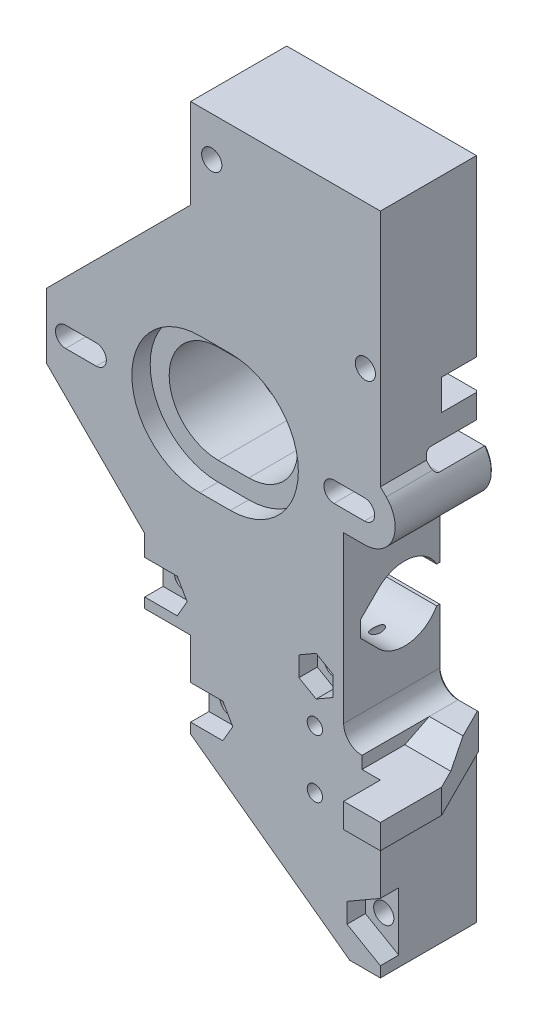
from build123d import *

# Parameters (mm, degrees)
SKETCH1_R                = 8
SKETCH1_R_2              = 1.65
BOSS_EXTRUDE1_DEPTH      = 16
CUT_EXTRUDE1_DEPTH       = 74.561199011
CUT_EXTRUDE1_DEPTH_BACK  = 14
CUT_EXTRUDE12_DEPTH      = 74.561199033
CUT_EXTRUDE20_DEPTH      = 6
SKETCH19_R               = 11.1
CUT_EXTRUDE24_DEPTH      = 3
CUT_EXTRUDE26_DEPTH      = 3
CHAMFER4_SIZE            = 6
CHAMFER4_SIZE2           = 12
CHAMFER5_START           = -47
CHAMFER5_OUTLINE_W       = 31
CHAMFER5_OUTLINE_H       = 25
CHAMFER5_DEPTH           = 10.119933969
CUT_EXTRUDE27_DEPTH      = 74.561199033
CUT_EXTRUDE28_DEPTH      = 3
SKETCH24_W               = 6
SKETCH24_H               = 6
BOSS_EXTRUDE2_DEPTH      = 6
CUT_EXTRUDE29_REACH      = 91.157
CUT_EXTRUDE29_END_RADIUS = 8
FILLET1_R                = 3
SKETCH26_W               = 9
SKETCH26_H               = 13
CUT_EXTRUDE30_DEPTH      = 2
CHAMFER6_SIZE            = 4
CHAMFER6_SIZE_2          = 2
CHAMFER7_SIZE            = 0.3
SKETCH27_R               = 1.25
CUT_EXTRUDE31_DEPTH      = 10


with BuildPart() as part:
    # Sketch1 → Boss-Extrude1 (new body)
    with BuildSketch(Plane.XY):
        with BuildLine():
            Line((18.5, -5), (18.5, -35))
            Line((18.5, -35), (30.5, -35))
            Line((30.5, -35), (30.5, -41))
            Line((30.5, -41), (24.5, -41))
            Line((24.5, -41), (24.5, -65))
            Line((24.5, -65), (-6.5, -65))
            Line((-6.5, -65), (-6.5, -32))
            Line((-6.5, -32), (-14, -32))
            Line((-14, -32), (-14, -21.355339059))
            Line((-14, -21.355339059), (-30, -5.355339059))
            Line((-30, -5.355339059), (-30, 5.355339059))
            Line((-30, 5.355339059), (-6.5, 28.855339059))
            Line((-6.5, 28.855339059), (-6.5, 43.5))
            Line((-6.5, 43.5), (24.5, 43.5))
            Line((24.5, 43.5), (24.5, 4.491378029))
            Line((24.5, 4.491378029), (25.455844123, 3.535533906))
            ThreePointArc((25.455844123, 3.535533906), (26.539707879, -1.913417162), (21.920310217, -5))
            Line((21.920310217, -5), (18.5, -5))
        make_face()
        Circle(SKETCH1_R, mode=Mode.SUBTRACT)
        with Locations((22.05, 20)):
            Circle(SKETCH1_R_2, mode=Mode.SUBTRACT)
        with Locations((-3.05, 37)):
            Circle(SKETCH1_R_2, mode=Mode.SUBTRACT)
        with Locations((21.920310217, 0)):
            Circle(SKETCH1_R_2, mode=Mode.SUBTRACT)
        with Locations((-21.920310217, 0)):
            Circle(SKETCH1_R_2, mode=Mode.SUBTRACT)
        with Locations((14, -27.55)):
            Circle(SKETCH1_R_2, mode=Mode.SUBTRACT)
        with Locations((-10.5, -27.55)):
            Circle(SKETCH1_R_2, mode=Mode.SUBTRACT)
        with Locations((-3.05, -41.5)):
            Circle(SKETCH1_R_2, mode=Mode.SUBTRACT)
        with Locations((22.05, -58.5)):
            Circle(SKETCH1_R_2, mode=Mode.SUBTRACT)
    extrude(amount=BOSS_EXTRUDE1_DEPTH)

    # Sketch2 → Cut-Extrude1 (cut, two sides: drawn at the far end of the back side and taken through both)
    with BuildSketch(Plane(origin=(0, 0, 0), x_dir=(0, 0, -1), z_dir=(1, 0, 0)).offset(-CUT_EXTRUDE1_DEPTH_BACK)):
        with BuildLine():
            Line((-0.800624517, -17.042859144), (0, -17.042859144))
            Line((0, -17.042859144), (0, -22.957140856))
            Line((0, -22.957140856), (-0.800624517, -22.957140856))
            ThreePointArc((-0.800624517, -22.957140856), (-5.231998533, -25.969212561), (-10.310318357, -24.260318357))
            Line((-10.310318357, -24.260318357), (-13.275, -21.295636713))
            Line((-13.275, -21.295636713), (-13.275, -18.704363287))
            Line((-13.275, -18.704363287), (-10.310318357, -15.739681643))
            ThreePointArc((-10.310318357, -15.739681643), (-5.231998533, -14.030787439), (-0.800624517, -17.042859144))
        make_face()
    extrude(amount=CUT_EXTRUDE1_DEPTH + CUT_EXTRUDE1_DEPTH_BACK, mode=Mode.SUBTRACT)

    # Sketch7 → Cut-Extrude12 (cut, through all)
    with BuildSketch(Plane(origin=(0, 0, 0), x_dir=(0, 0, -1), z_dir=(1, 0, 0))):
        with BuildLine():
            Line((-7, 6.1), (0, 6.1))
            ThreePointArc((0, 6.1), (1.5, 4.6), (0, 3.1))
            Line((0, 3.1), (-7, 3.1))
            ThreePointArc((-7, 3.1), (-8.5, 4.6), (-7, 6.1))
        make_face()
        with BuildLine():
            Line((-7, -6.1), (0, -6.1))
            ThreePointArc((0, -6.1), (1.5, -4.6), (0, -3.1))
            Line((0, -3.1), (-7, -3.1))
            ThreePointArc((-7, -3.1), (-8.5, -4.6), (-7, -6.1))
        make_face()
    extrude(amount=CUT_EXTRUDE12_DEPTH, mode=Mode.SUBTRACT)

    # Sketch15 → Cut-Extrude20 (cut)
    with BuildSketch(Plane(origin=(24.5, 0, 0), x_dir=(0, 0, -1), z_dir=(1, 0, 0))):
        Polygon((0, 10), (-8, 10), (-8, 15), (0, 15), (0, 14.529529041), align=None)
    extrude(amount=-CUT_EXTRUDE20_DEPTH, mode=Mode.SUBTRACT)

    # Chamfer1
    # the kernel refuses this chamfer: 8 mm, written as the material it adds along each edge
    with BuildSketch(Plane(origin=(18.5, 10, 8), x_dir=(0, 0, -1), z_dir=(0, 1, 0))) as chamfer1_piece_1_section:
        with BuildLine():
            Line((8.22627417, 0.22627417), (-0.22627417, -8.22627417))
            Line((-0.22627417, -8.22627417), (-0.38627417, -8.22627417))
            ThreePointArc((-0.38627417, -8.22627417), (-0.16, -4.113137085), (-0.16, 0))
            Line((-0.16, 0), (0, 0.16))
            ThreePointArc((0, 0.16), (4.113137085, 0.16), (8.22627417, 0.38627417))
            Line((8.22627417, 0.38627417), (8.22627417, 0.22627417))
        make_face()
    chamfer1_piece_1 = extrude(amount=5, mode=Mode.PRIVATE)
    chamfer1_piece_1 = split(chamfer1_piece_1, bisect_by=Plane(origin=(18.5, 10, 0), z_dir=(0, 0, 1)), keep=Keep.TOP, mode=Mode.PRIVATE)
    chamfer1_piece_1 = split(chamfer1_piece_1, bisect_by=Plane(origin=(24.5, 10, 8), z_dir=(-1, 0, 0)), keep=Keep.TOP, mode=Mode.PRIVATE)
    add(chamfer1_piece_1)

    # Sketch19 → Cut-Extrude24 (cut)
    with BuildSketch(Plane.XY.offset(16)):
        Circle(SKETCH19_R)
    extrude(amount=-CUT_EXTRUDE24_DEPTH, mode=Mode.SUBTRACT)

    # Sketch21 → Cut-Extrude26 (cut)
    with BuildSketch(Plane.XY.offset(16)):
        Polygon((24.65, -53.650257739), (24.65, -63.349742261), (19.05, -60.116580754), (19.05, -56.883419246), align=None)
        Polygon((-7.066838493, -27.55), (-8.683419246, -24.75), (-14, -24.75), (-14, -30.35), (-8.683419246, -30.35), align=None)
        Polygon((11.2, -25.933419246), (11.2, -29.166580754), (14, -30.783161507), (16.8, -29.166580754), (16.8, -25.933419246), (14, -24.316838493), align=None)
        Polygon((-6.5, -44.3), (-1.233419246, -44.3), (0.383161507, -41.5), (-1.233419246, -38.7), (-6.5, -38.7), align=None)
    extrude(amount=-CUT_EXTRUDE26_DEPTH, mode=Mode.SUBTRACT)

    # Chamfer4
    chamfer4_edges = [part.edges().sort_by_distance(p)[0] for p in [
        (30.5, -38, 0),
    ]]
    chamfer4_side = [part.faces().sort_by_distance(p)[0] for p in [
        (7.902642587, -43.922906685, 0),
    ]]
    chamfer(chamfer4_edges, length=CHAMFER4_SIZE, length2=CHAMFER4_SIZE2, reference=chamfer4_side[0])

    # Chamfer5: read off the stored shape, not the designer's step
    # Chamfer5 outline → Chamfer5 (cut)
    with BuildSketch(Plane(origin=(0, 0, 0), x_dir=(0.9390354893354782, -0.17226640520126585, 0.29755106352945915), z_dir=(0.3438202288529268, 0.4704908394829528, -0.8126659954705546)).offset(CHAMFER5_START)):
        with Locations((20.5, 42.5)):
            Rectangle(CHAMFER5_OUTLINE_W, CHAMFER5_OUTLINE_H)
    extrude(amount=CHAMFER5_DEPTH, mode=Mode.SUBTRACT)

    # Sketch22 → Cut-Extrude27 (cut, through all)
    with BuildSketch(Plane.XY.offset(16)):
        with BuildLine():
            Line((21.920310217, -1.65), (16.920310217, -1.65))
            ThreePointArc((16.920310217, -1.65), (15.270310217, 0), (16.920310217, 1.65))
            Line((16.920310217, 1.65), (21.920310217, 1.65))
            ThreePointArc((21.920310217, 1.65), (23.570310217, 0), (21.920310217, -1.65))
        make_face()
        with BuildLine():
            Line((-21.920310217, -1.65), (-26.920310217, -1.65))
            ThreePointArc((-26.920310217, -1.65), (-28.570310217, 0), (-26.920310217, 1.65))
            Line((-26.920310217, 1.65), (-21.920310217, 1.65))
            ThreePointArc((-21.920310217, 1.65), (-20.270310217, 0), (-21.920310217, -1.65))
        make_face()
        with BuildLine():
            Line((0, -8), (-5, -8))
            ThreePointArc((-5, -8), (-13, 0), (-5, 8))
            Line((-5, 8), (0, 8))
            ThreePointArc((0, 8), (8, 0), (0, -8))
        make_face()
    extrude(amount=-CUT_EXTRUDE27_DEPTH, mode=Mode.SUBTRACT)

    # Sketch23 → Cut-Extrude28 (cut)
    with BuildSketch(Plane.XY.offset(16)):
        with BuildLine():
            Line((0, -11.1), (-5, -11.1))
            ThreePointArc((-5, -11.1), (-16.1, 0), (-5, 11.1))
            Line((-5, 11.1), (0, 11.1))
            ThreePointArc((0, 11.1), (11.1, 0), (0, -11.1))
        make_face()
    extrude(amount=-CUT_EXTRUDE28_DEPTH, mode=Mode.SUBTRACT)

    # Sketch24 → Boss-Extrude2 (add)
    with BuildSketch(Plane.XZ.offset(41)):
        with Locations((27.5, 19)):
            Rectangle(SKETCH24_W, SKETCH24_H)
    extrude(amount=-BOSS_EXTRUDE2_DEPTH)

    # Cut-Extrude29: up to this cylinder (the profile starts outside it)
    cut_extrude29_end = Plane(origin=(0, 0, 7.712859), z_dir=(0, 0, -1)) * Cylinder(CUT_EXTRUDE29_END_RADIUS, 199.314, mode=Mode.PRIVATE)
    # Sketch25 → Cut-Extrude29 (cut, up to the surface)
    with BuildSketch(Plane(origin=(26.920310217, 0, 0), x_dir=(0, 0, -1), z_dir=(1, 0, 0)), mode=Mode.PRIVATE) as cut_extrude29_sk1:
        with BuildLine():
            Line((-7, 6.1), (-7.7, 6.1))
            ThreePointArc((-7.7, 6.1), (-8.265685425, 5.865685425), (-8.5, 5.3))
            Line((-8.5, 5.3), (-8.5, 3.9))
            ThreePointArc((-8.5, 3.9), (-8.265685425, 3.334314575), (-7.7, 3.1))
            Line((-7.7, 3.1), (-7, 3.1))
            Line((-7, 3.1), (-7, 6.1))
        make_face()
    cut_extrude29_tool1 = extrude(cut_extrude29_sk1.sketch, amount=-CUT_EXTRUDE29_REACH, mode=Mode.PRIVATE) - cut_extrude29_end
    add(cut_extrude29_tool1.solids().sort_by_distance((26.92031, 4.6, 7.712859))[0], mode=Mode.SUBTRACT)
    # Sketch25 → Cut-Extrude29 (cut, up to the surface)
    with BuildSketch(Plane(origin=(26.920310217, 0, 0), x_dir=(0, 0, -1), z_dir=(1, 0, 0)), mode=Mode.PRIVATE) as cut_extrude29_sk2:
        with BuildLine():
            Line((-7, -3.1), (-7.7, -3.1))
            ThreePointArc((-7.7, -3.1), (-8.265685425, -3.334314575), (-8.5, -3.9))
            Line((-8.5, -3.9), (-8.5, -5.3))
            ThreePointArc((-8.5, -5.3), (-8.265685425, -5.865685425), (-7.7, -6.1))
            Line((-7.7, -6.1), (-7, -6.1))
            Line((-7, -6.1), (-7, -3.1))
        make_face()
    cut_extrude29_tool2 = extrude(cut_extrude29_sk2.sketch, amount=-CUT_EXTRUDE29_REACH, mode=Mode.PRIVATE) - cut_extrude29_end
    add(cut_extrude29_tool2.solids().sort_by_distance((26.92031, -4.6, 7.712859))[0], mode=Mode.SUBTRACT)

    # Fillet1
    fillet1_edges = [part.edges().sort_by_distance(p)[0] for p in [
        (18.5, -35, 8),
    ]]
    fillet(fillet1_edges, radius=FILLET1_R)

    # Sketch26 → Cut-Extrude30 (cut)
    with BuildSketch(Plane(origin=(0, -35, 0), x_dir=(1, 0, 0), z_dir=(0, 1, 0))):
        with Locations((26, -15.5)):
            Rectangle(SKETCH26_W, SKETCH26_H)
    extrude(amount=-CUT_EXTRUDE30_DEPTH, mode=Mode.SUBTRACT)

    # Chamfer6
    # the kernel refuses this chamfer: 4, 2 mm, written as the material it takes off along each edge
    with BuildSketch(Plane(origin=(21.5, -35, 9), x_dir=(0, 0, -1), z_dir=(1, 0, 0))) as chamfer6_piece_1:
        Polygon((CHAMFER6_SIZE, 0), (0, -CHAMFER6_SIZE_2), (0, 0), align=None)
    extrude(amount=17.859315495, mode=Mode.SUBTRACT)

    # Chamfer7
    chamfer7_edges = [part.edges().sort_by_distance(p)[0] for p in [
        (23, -35, 0),
        (19.378679656, -34.121320344, 0),
        (18.5, -27.478570428, 0),
        (24.5, -53, 0),
        (9, -65, 0),
        (-6.5, -48.5, 0),
        (-10.25, -32, 0),
        (-14, -27.478570428, 0),
        (2.25, -22.957140856, 0),
        (16.609138446, -3.1, 0),
        (8, 0, 0),
        (16.609138446, 3.1, 0),
        (26.920310217, 0, 0),
        (15.270310217, 0, 0),
        (19.420310217, -1.65, 0),
        (19.420310217, 1.65, 0),
        (-28.570310217, 0, 0),
        (-24.420310217, -1.65, 0),
        (-24.420310217, 1.65, 0),
        (24.5, 8.05, 0),
        (14.837952859, 6.1, 0),
        (2.75680975, 7.509993342, 0),
        (-2.5, 8, 0),
        (-13, 0, 0),
        (-2.5, -8, 0),
        (2.75680975, -7.509993342, 0),
        (11.837952859, -6.1, 0),
        (18.5, -11.571429572, 0),
        (2.25, -17.042859144, 0),
        (-14, -19.199099102, 0),
        (-22, -13.355339059, 0),
        (-30, 0, 0),
        (-6.5, 36.17766953, 0),
        (9, 43.5, 0),
        (24.5, 29.25, 0),
        (-18.25, 17.105339059, 0),
        (-20.270310217, 0, 0),
        (23.570310217, 0, 0),
        (20.4, -58.5, 0),
        (-12.15, -27.55, 0),
        (-4.7, -41.5, 0),
        (12.35, -27.55, 0),
        (-4.7, 37, 0),
        (20.4, 20, 0),
    ]]
    chamfer(chamfer7_edges, length=CHAMFER7_SIZE)

    # Sketch27 → Cut-Extrude31 (cut)
    with BuildSketch(Plane.XY.offset(16)):
        with Locations((13.8, -34.666580754)):
            Circle(SKETCH27_R)
        with Locations((13.8, -44.166580754)):
            Circle(SKETCH27_R)
    extrude(amount=-CUT_EXTRUDE31_DEPTH, mode=Mode.SUBTRACT)


solid = part.part
